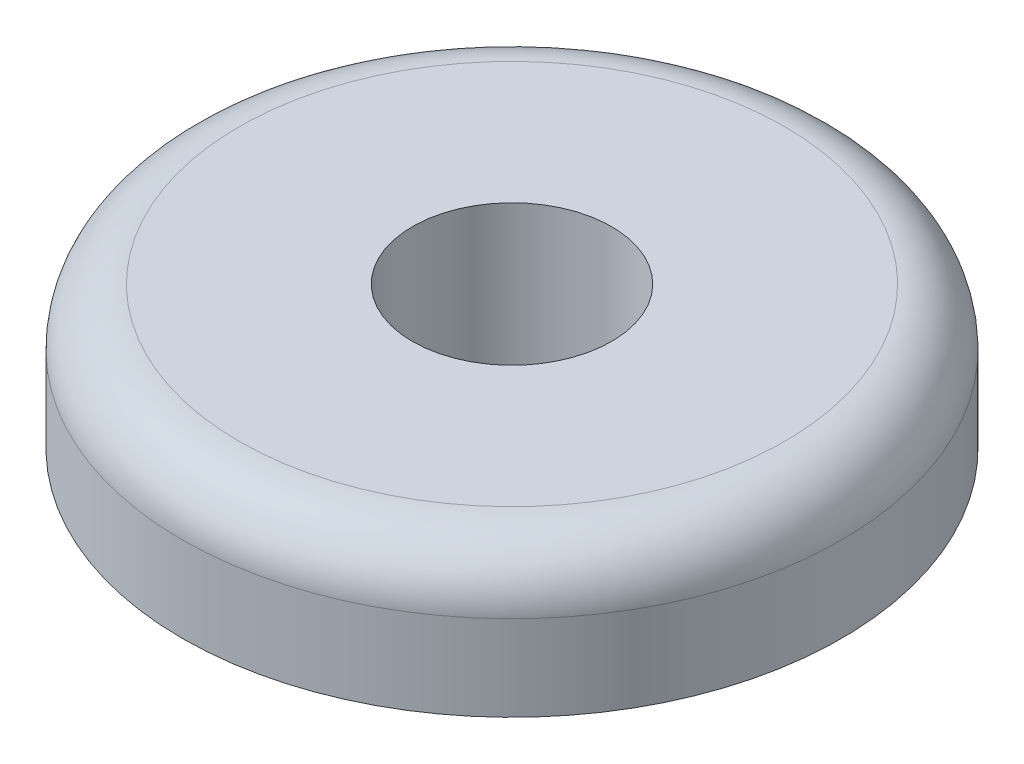
from build123d import *

# Parameters (mm, degrees)
SKETCH1_R           = 11.587
SKETCH1_R_2         = 3.5
BOSS_EXTRUDE1_DEPTH = 5
FILLET1_R           = 2


with BuildPart() as part:
    # Sketch1 → Boss-Extrude1 (new body)
    with BuildSketch(Plane(origin=(0, 0, 0), x_dir=(1, 0, 0), z_dir=(0, 1, 0))):
        Circle(SKETCH1_R)
        Circle(SKETCH1_R_2, mode=Mode.SUBTRACT)
    extrude(amount=BOSS_EXTRUDE1_DEPTH)

    # Fillet1
    fillet1_edges = [part.edges().sort_by_distance(p)[0] for p in [
        (-11.587, 5, 0),
    ]]
    fillet(fillet1_edges, radius=FILLET1_R)


solid = part.part
